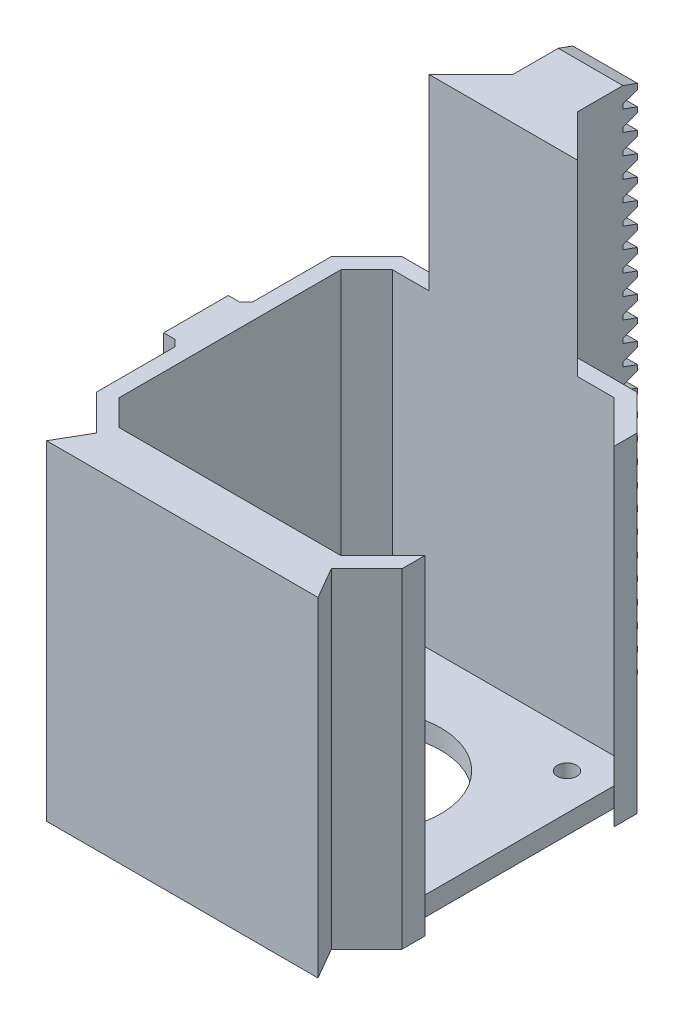
from build123d import *

# Parameters (mm, degrees)
SKETCH1_R           = 1.5
SKETCH1_R_2         = 11.5
BOSS_EXTRUDE1_DEPTH = 3
BOSS_EXTRUDE2_DEPTH = 51
BOSS_EXTRUDE3_DEPTH = 51
SKETCH11_W          = 1
SKETCH11_H          = 51
BOSS_EXTRUDE4_DEPTH = 5
BOSS_EXTRUDE6_DEPTH = 10
CHAMFER1_SIZE       = 4
BOSS_EXTRUDE7_DEPTH = 29
SKETCH16_W          = 2.75
SKETCH16_H          = 10
BOSS_EXTRUDE8_DEPTH = 4
CHAMFER2_SIZE       = 1
CHAMFER3_SIZE       = 1


with BuildPart() as part:
    # Sketch1 → Boss-Extrude1 (new body)
    with BuildSketch(Plane(origin=(0, 0, 0), x_dir=(1, 0, 0), z_dir=(0, 1, 0))):
        Polygon((-21.15, 17.15), (-17.15, 21.15), (17.15, 21.15), (21.15, 17.15), (21.15, -17.15), (17.15, -21.15), (-17.15, -21.15), (-21.15, -17.15), align=None)
        with Locations(Location((-15.5, 15.5, 0), (0, 0, 270))):
            Circle(SKETCH1_R, mode=Mode.SUBTRACT)
        with Locations(Location((15.5, 15.5, 0), (0, 0, 270))):
            Circle(SKETCH1_R, mode=Mode.SUBTRACT)
        with Locations(Location((15.5, -15.5, 0), (0, 0, 270))):
            Circle(SKETCH1_R, mode=Mode.SUBTRACT)
        with Locations(Location((-15.5, -15.5, 0), (0, 0, 270))):
            Circle(SKETCH1_R, mode=Mode.SUBTRACT)
        with Locations(Location((0, 0, 0), (0, 0, 270))):
            Circle(SKETCH1_R_2, mode=Mode.SUBTRACT)
    extrude(amount=BOSS_EXTRUDE1_DEPTH)

    # Sketch5 → Boss-Extrude2 (add)
    with BuildSketch(Plane(origin=(0, 0, 0), x_dir=(1, 0, 0), z_dir=(0, 1, 0))):
        Polygon((21.15, -17.15), (23.65, -14.65), (23.65, -18.185533906), (18.185533906, -23.65), (-18.185533906, -23.65), (-23.65, -18.185533906), (-23.65, 14.65), (-23.65, 18.185533906), (-18.185533906, 23.65), (18.185533906, 23.65), (23.65, 18.185533906), (23.65, 14.65), (21.15, 17.15), (17.15, 21.15), (-17.15, 21.15), (-21.15, 17.15), (-21.15, -17.15), (-17.15, -21.15), (17.15, -21.15), align=None)
    extrude(amount=BOSS_EXTRUDE2_DEPTH)

    # Sketch9 → Boss-Extrude3 (add)
    with BuildSketch(Plane(origin=(0, 0, 0), x_dir=(1, 0, 0), z_dir=(0, 1, 0))):
        Polygon((-18.185533906, -23.65), (-21, -28.524798271), (21, -28.524798271), (18.185533906, -23.65), align=None)
    extrude(amount=BOSS_EXTRUDE3_DEPTH)

    # Sketch11 → Boss-Extrude4 (add, symmetric)
    with BuildSketch(Plane(origin=(0, 0, 0), x_dir=(0, 0, -1), z_dir=(1, 0, 0))):
        with Locations((24.15, 25.5)):
            Rectangle(SKETCH11_W, SKETCH11_H)
    extrude(amount=BOSS_EXTRUDE4_DEPTH, both=True)

    # Sketch13 → Boss-Extrude6 (add)
    with BuildSketch(Plane(origin=(5, 0, 0), x_dir=(0, 0, -1), z_dir=(1, 0, 0))):
        Polygon((24.65, 80), (34.65, 80), (36.9, 79.181067), (36.9, 78.3382111), (34.65, 77.5192781), (34.65, 76.8584073), (36.9, 76.0394743), (36.9, 75.1966185), (34.65, 74.3776854), (34.65, 73.7168147), (36.9, 72.8978817), (36.9, 72.0550258), (34.65, 71.2360928), (34.65, 70.575222), (36.9, 69.756289), (36.9, 68.9134332), (34.65, 68.0945001), (34.65, 67.4336294), (36.9, 66.6146964), (36.9, 65.7718405), (34.65, 64.9529075), (34.65, 64.2920367), (36.9, 63.4731037), (36.9, 62.6302478), (34.65, 61.8113148), (34.65, 61.1504441), (36.9, 60.3315111), (36.9, 59.4886552), (34.65, 58.6697222), (34.65, 58.0088514), (36.9, 57.1899184), (36.9, 56.3470625), (34.65, 55.5281295), (34.65, 54.8672588), (36.9, 54.0483257), (36.9, 53.2054699), (34.65, 52.3865369), (34.65, 51.7256661), (36.9, 50.9067331), (36.9, 50.0638772), (34.65, 49.2449442), (34.65, 48.5840735), (36.9, 47.7651404), (36.9, 46.9222846), (34.65, 46.1033516), (34.65, 45.4424808), (36.9, 44.6235478), (36.9, 43.7806919), (34.65, 42.9617589), (34.65, 42.3008882), (36.9, 41.4819551), (36.9, 40.6390993), (34.65, 39.8201662), (34.65, 39.1592955), (36.9, 38.3403625), (36.9, 37.4975066), (34.65, 36.6785736), (34.65, 36.0177028), (36.9, 35.1987698), (36.9, 34.355914), (34.65, 33.5369809), (34.65, 32.8761102), (36.9, 32.0571772), (36.9, 31.2143213), (34.65, 30.3953883), (34.65, 29.7345175), (36.9, 28.9155845), (36.9, 28.0727287), (34.65, 27.2537956), (34.65, 26.5929249), (36.9, 25.7739919), (36.9, 24.931136), (34.65, 24.112203), (34.65, 23.4513322), (36.9, 22.6323992), (36.9, 21.7895434), (34.65, 20.9706103), (34.65, 20.3097396), (36.9, 19.4908066), (36.9, 18.6479507), (34.65, 17.8290177), (34.65, 17.1681469), (36.9, 16.3492139), (36.9, 15.506358), (34.65, 14.687425), (34.65, 14.0265543), (36.9, 13.2076212), (36.9, 12.3647654), (34.65, 11.5458324), (34.65, 10.8849616), (36.9, 10.0660286), (36.9, 9.2231727), (34.65, 8.4042397), (34.65, 7.743369), (36.9, 6.9244359), (36.9, 6.0815801), (34.65, 5.2626471), (34.65, 4.6017763), (36.9, 3.7828433), (36.9, 2.9399874), (34.65, 2.1210544), (34.65, 1.4601837), (36.9, 0.6412506), (36.9, 0), (24.65, 0), align=None)
    extrude(amount=-BOSS_EXTRUDE6_DEPTH)

    # Chamfer1
    chamfer1_edges = [part.edges().sort_by_distance(p)[0] for p in [
        (5, 25.5, -23.65),
    ]]
    chamfer(chamfer1_edges, length=CHAMFER1_SIZE)
    chamfer1_2_edges = [part.edges().sort_by_distance(p)[0] for p in [
        (-5, 25.5, -23.65),
    ]]
    chamfer(chamfer1_2_edges, length=CHAMFER1_SIZE)

    # Sketch15 → Boss-Extrude7 (add)
    with BuildSketch(Plane(origin=(0, 51, 0), x_dir=(1, 0, 0), z_dir=(0, 1, 0))):
        Polygon((-8, 24.65), (-11.5, 21.15), (11.5, 21.15), (8, 24.65), align=None)
    extrude(amount=BOSS_EXTRUDE7_DEPTH)

    # Sketch16 → Boss-Extrude8 (add)
    with BuildSketch(Plane(origin=(0, 51, 0), x_dir=(1, 0, 0), z_dir=(0, 1, 0))):
        with Locations((-25.025, 0)):
            Rectangle(SKETCH16_W, SKETCH16_H)
    extrude(amount=-BOSS_EXTRUDE8_DEPTH)

    # Chamfer2
    chamfer2_edges = [part.edges().sort_by_distance(p)[0] for p in [
        (-23.65, 47, 0),
    ]]
    chamfer(chamfer2_edges, length=CHAMFER2_SIZE)

    # Chamfer3
    chamfer3_edges = [part.edges().sort_by_distance(p)[0] for p in [
        (-23.65, 48.5, -5),
        (-23.65, 48.5, 5),
    ]]
    chamfer(chamfer3_edges, length=CHAMFER3_SIZE)


solid = part.part
